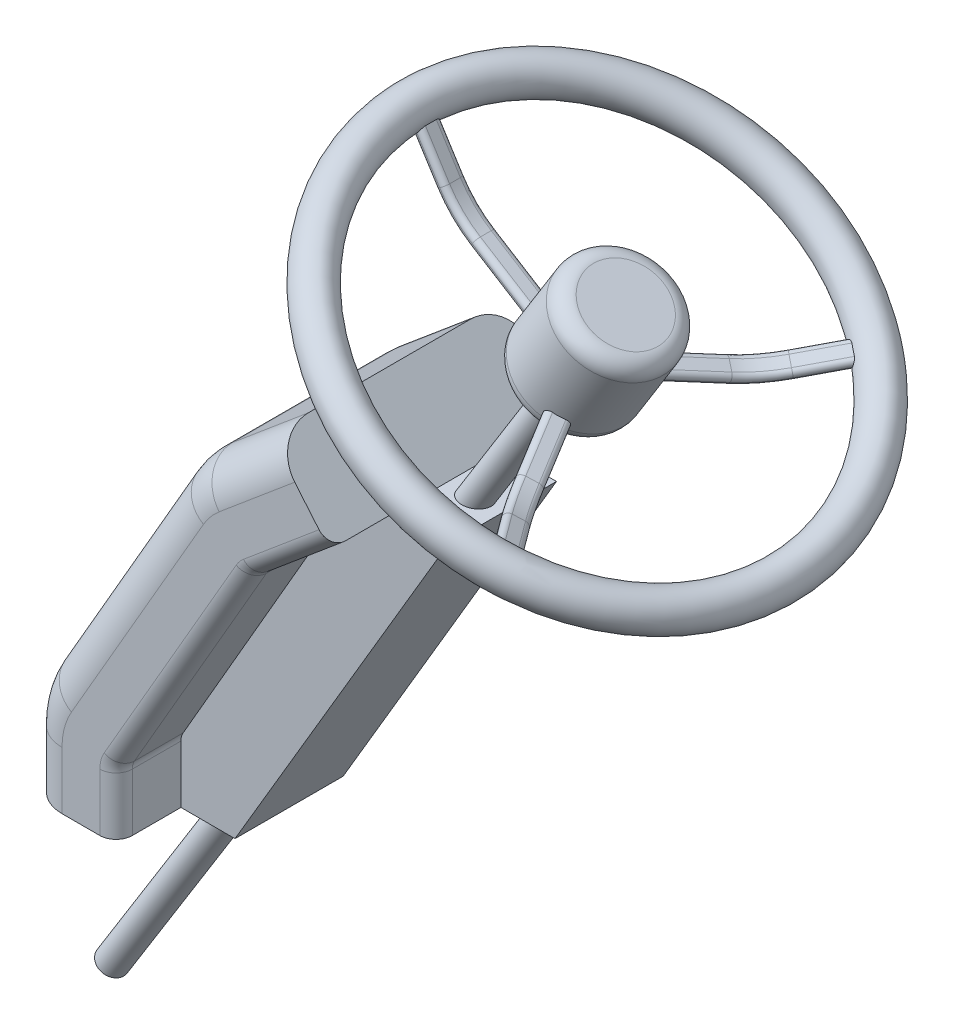
from build123d import *

# Parameters (mm, degrees)
EXTRUDE_THIN1_DEPTH      = 110
FILLET1_R                = 35
FILLET2_R                = 15
BOSS_EXTRUDE1_DEPTH      = 50
BOSS_EXTRUDE2_DEPTH      = 649
BOSS_EXTRUDE2_DEPTH_BACK = 150
SKETCH3_R                = 12.5
SKETCH4_R                = 17.5
FILLET3_R                = 15
EXTRUDE_THIN2_DEPTH      = 10
FILLET4_R                = 5
CIRPATTERN1_COUNT        = 3
FILLET4_OF_CIRPATTERN1_R = 5


with BuildPart() as part:
    # Sketch1 → Extrude-Thin1 (new, symmetric)
    with BuildSketch(Plane.XY):
        with BuildLine():
            Line((0, 0), (0, 53.205080757))
            ThreePointArc((0, 53.205080757), (3.407417371, 79.086985267), (13.397459622, 103.205080757))
            Line((13.397459622, 103.205080757), (135.521218262, 314.729635533))
            ThreePointArc((135.521218262, 314.729635533), (145.519314329, 329.008396502), (157.844997672, 341.334079845))
            Line((157.844997672, 341.334079845), (227.760318779, 400))
            Line((227.760318779, 400), (282.397265602, 334.886222335))
            Line((282.397265602, 334.886222335), (212.481944495, 276.22030218))
            ThreePointArc((212.481944495, 276.22030218), (210.633091994, 274.371449679), (209.133377584, 272.229635533))
            Line((209.133377584, 272.229635533), (87.009618943, 60.705080757))
            ThreePointArc((87.009618943, 60.705080757), (85.511112606, 57.087366433), (85, 53.205080757))
            Line((85, 53.205080757), (85, 0))
            Line((85, 0), (0, 0))
        make_face()
    extrude(amount=EXTRUDE_THIN1_DEPTH, both=True)

    # Fillet1
    fillet1_edges = [part.edges().sort_by_distance(p)[0] for p in [
        (0, 26.602540378, -110),
        (3.407417371, 79.086985267, -110),
        (74.459338942, 208.967358145, -110),
        (192.802658225, 370.667039923, 110),
        (145.519314329, 329.008396502, -110),
        (192.802658225, 370.667039923, -110),
        (145.519314329, 329.008396502, 110),
        (74.459338942, 208.967358145, 110),
        (3.407417371, 79.086985267, 110),
        (0, 26.602540378, 110),
    ]]
    fillet(fillet1_edges, radius=FILLET1_R)

    # Fillet2
    fillet2_edges = [part.edges().sort_by_distance(p)[0] for p in [
        (210.633091994, 274.371449679, -110),
        (148.071498263, 166.467358145, -110),
        (85.511112606, 57.087366433, -110),
        (85, 26.602540378, -110),
        (247.439605049, 305.553262258, -110),
        (85, 26.602540378, 110),
        (85.511112606, 57.087366433, 110),
        (148.071498263, 166.467358145, 110),
        (210.633091994, 274.371449679, 110),
        (247.439605049, 305.553262258, 110),
    ]]
    fillet(fillet2_edges, radius=FILLET2_R)

    # Sketch2 → Boss-Extrude1 (add, symmetric)
    with BuildSketch(Plane.XY):
        with BuildLine():
            Line((85, 53.205080757), (85, 0))
            Line((85, 0), (135, 0))
            Line((135, 0), (332.397265602, 334.886222335))
            Line((332.397265602, 334.886222335), (282.397265602, 334.886222335))
            Line((282.397265602, 334.886222335), (212.481944495, 276.22030218))
            ThreePointArc((212.481944495, 276.22030218), (210.633091994, 274.371449679), (209.133377584, 272.229635533))
            Line((209.133377584, 272.229635533), (87.009618943, 60.705080757))
            ThreePointArc((87.009618943, 60.705080757), (85.511112606, 57.087366433), (85, 53.205080757))
        make_face()
    extrude(amount=BOSS_EXTRUDE1_DEPTH, both=True)

    # Sketch3 → Boss-Extrude2 (add, two sides: drawn at the far end of the back side and taken through both)
    with BuildSketch(Plane(origin=(243.008497684, 390.511319748, 0), x_dir=(-0.8490335127649609, 0.5283389955341089, 0), z_dir=(-0.5283389955341089, -0.8490335127649609, 0)).offset(-BOSS_EXTRUDE2_DEPTH_BACK)):
        with Locations(Location((-84.057129902, 0, 0), (0, 0, 180))):
            Circle(SKETCH3_R)
    extrude(amount=BOSS_EXTRUDE2_DEPTH + BOSS_EXTRUDE2_DEPTH_BACK)

    # Sketch4 → Revolve1 (revolve)
    with BuildSketch(Plane.XY):
        with Locations((250.236914511, 621.575161827)):
            Circle(SKETCH4_R)
        Polygon((393.626667288, 473.455687082), (446.460566841, 558.359038359), (404.008891203, 584.775988136), (351.174991649, 499.872636859), align=None)
    revolve(axis=Axis((399.551692108, 482.977120629, 0), (-0.5283389955341089, -0.8490335127649609, 0)))


with BuildPart() as revolve1_piece_1:
    # of the separate pieces the step leaves, piece 1, a body of its own (revolve1_pieces)
    add(part.part.solids().sort_by_distance((404.008891203, 584.775988136, 0))[0])

    # Fillet3
    fillet3_edges = [revolve1_piece_1.edges().sort_by_distance(p)[0] for p in [
        (488.912242479, 531.942088582, 0),
        (436.078342926, 447.038737306, 0),
    ]]
    fillet(fillet3_edges, radius=FILLET3_R)


with BuildPart() as revolve1_piece_2:
    # of the separate pieces the step leaves, piece 2, a body of its own (revolve1_pieces)
    add(part.part.solids().sort_by_distance((267.736914511, 621.575161827, 0))[0])

    # Sketch6 → Extrude-Thin2 (add, symmetric)
    with BuildSketch(Plane.XY):
        with BuildLine():
            Line((249.722112478, 621.457545395), (280.064393504, 573.512358628))
            ThreePointArc((280.064393504, 573.512358628), (294.122581764, 556.010328478), (311.730722842, 542.08527608))
            Line((311.730722842, 542.08527608), (360.224404974, 511.908489273))
            Line((360.224404974, 511.908489273), (365.507794929, 520.398824401))
            Line((365.507794929, 520.398824401), (317.014112798, 550.575611208))
            ThreePointArc((317.014112798, 550.575611208), (301.166785827, 563.108158366), (288.514416393, 578.859985501))
            Line((288.514416393, 578.859985501), (258.172135367, 626.805172268))
            Line((258.172135367, 626.805172268), (249.722112478, 621.457545395))
        make_face()
    extrude_thin2 = extrude(amount=EXTRUDE_THIN2_DEPTH, both=True)

    # Fillet4
    fillet4_edges = [revolve1_piece_2.edges().sort_by_distance(p)[0] for p in [
        (269.6818544, 589.918270102, -10),
        (335.977563908, 526.996882677, -10),
        (269.6818544, 589.918270102, 10),
        (335.977563908, 526.996882677, 10),
        (277.406027648, 596.412844253, -10),
        (341.260953863, 535.487217804, -10),
        (277.406027648, 596.412844253, 10),
        (341.260953863, 535.487217804, 10),
        (294.122581764, 556.010328478, -10),
        (294.122581764, 556.010328478, 10),
        (301.166785827, 563.108158366, -10),
        (301.166785827, 563.108158366, 10),
    ]]
    fillet(fillet4_edges, radius=FILLET4_R - 0.0001)  # a hair under: the kernel refuses the full size

    # CirPattern1: Extrude-Thin2 ×3 about axis
    cirpattern1_axis = Axis((71.367320274, -44.41065958, 0), (0.5283389955341082, 0.8490335127649613, 0))
    for i in range(1, CIRPATTERN1_COUNT):
        add(extrude_thin2.rotate(cirpattern1_axis, i * 360 / CIRPATTERN1_COUNT))

    # Fillet4 of CirPattern1
    fillet4_of_cirpattern1_edges = [revolve1_piece_2.edges().sort_by_distance(p)[0] for p in [
        (474.712649699, 462.331122112, 149.422747251),
        (426.98600047, 470.363893242, 71.886538702),
        (489.418341513, 453.180022273, 139.422747251),
        (441.691692284, 461.212793403, 61.886538702),
        (478.454755803, 471.303668361, 146.714906509),
        (432.269390425, 478.85422837, 71.886538702),
        (493.160447618, 462.152568522, 136.714906509),
        (446.975082239, 469.703128531, 61.886538702),
        (449.910429544, 459.066222298, 115.937109078),
        (464.616121359, 449.915122459, 105.937109078),
        (454.113718646, 467.931904849, 114.005261873),
        (468.81941046, 458.780805011, 104.005261873),
        (489.418341513, 453.180022273, -139.422747251),
        (441.691692284, 461.212793403, -61.886538702),
        (474.712649699, 462.331122112, -149.422747251),
        (426.98600047, 470.363893242, -71.886538702),
        (493.160447618, 462.152568522, -136.714906509),
        (446.975082239, 469.703128531, -61.886538702),
        (478.454755803, 471.303668361, -146.714906509),
        (432.269390425, 478.85422837, -71.886538702),
        (464.616121359, 449.915122459, -105.937109078),
        (449.910429544, 459.066222298, -115.937109078),
        (468.81941046, 458.780805011, -104.005261873),
        (454.113718646, 467.931904849, -114.005261873),
    ]]
    fillet(fillet4_of_cirpattern1_edges, radius=FILLET4_OF_CIRPATTERN1_R - 0.0001)  # a hair under: the kernel refuses the full size


solid = Compound([revolve1_piece_1.part, revolve1_piece_2.part])
